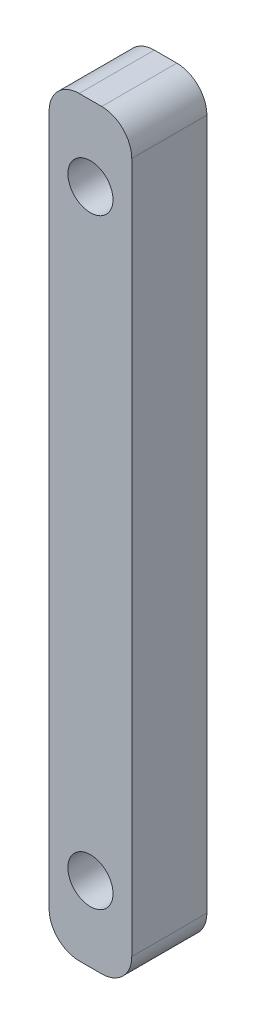
from build123d import *

# Parameters (mm, degrees)
SKETCH_1_W          = 5.5
SKETCH_1_H          = 50
EXTRUDE_1_DEPTH     = 5
SKETCH_2_R          = 1.5
CUT_EXTRUDE_1_DEPTH = 26.642981496
FILLET_1_R          = 2


with BuildPart() as part:
    # 草图1 → 凸台-拉伸1 (new body)
    with BuildSketch(Plane.XY):
        Rectangle(SKETCH_1_W, SKETCH_1_H)
    extrude(amount=EXTRUDE_1_DEPTH)

    # 草图2 → 切除-拉伸1 (cut, through all)
    with BuildSketch(Plane.XY.offset(5)):
        with Locations((0, 20)):
            Circle(SKETCH_2_R)
        with Locations((0, -20)):
            Circle(SKETCH_2_R)
    extrude(amount=-CUT_EXTRUDE_1_DEPTH, mode=Mode.SUBTRACT)

    # 圆角1
    fillet_1_edges = [part.edges().sort_by_distance(p)[0] for p in [
        (-2.75, -25, 2.5),
        (2.75, -25, 2.5),
        (2.75, 25, 2.5),
        (-2.75, 25, 2.5),
    ]]
    fillet(fillet_1_edges, radius=FILLET_1_R)


solid = part.part
